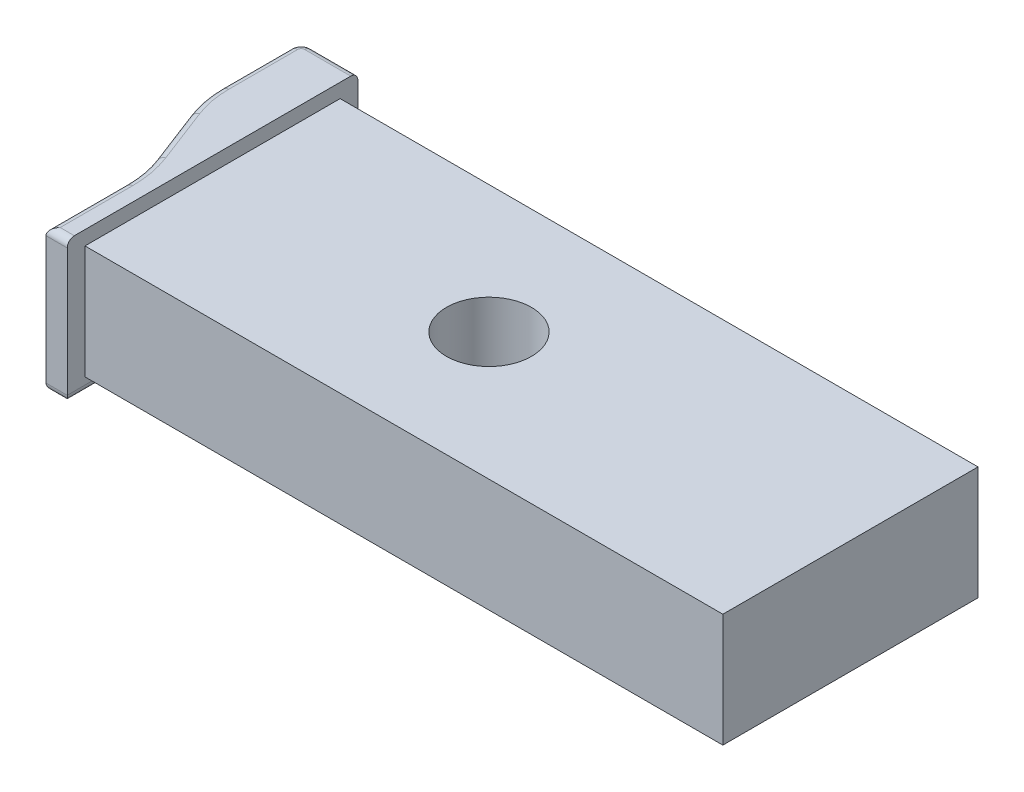
from build123d import *

# Parameters (mm, degrees)
SKETCH_1_W      = 90
SKETCH_1_H      = 36
SKETCH_1_R      = 6
EXTRUDE_1_DEPTH = 16
EXTRUDE_2_DEPTH = 20
FILLET_1_R      = 1
FILLET_2_R      = 1


with BuildPart() as part:
    # Эскиз1 → Бобышка-Вытянуть1 (new body)
    with BuildSketch(Plane(origin=(0, 0, 0), x_dir=(1, 0, 0), z_dir=(0, 1, 0))):
        Rectangle(SKETCH_1_W, SKETCH_1_H)
        with Locations((-6, 0)):
            Circle(SKETCH_1_R, mode=Mode.SUBTRACT)
    extrude(amount=EXTRUDE_1_DEPTH)

    # Эскиз3 → Бобышка-Вытянуть2 (add)
    with BuildSketch(Plane(origin=(0, 18, 0), x_dir=(1, 0, 0), z_dir=(0, 1, 0))):
        with BuildLine():
            Line((-45, 20.5), (-45, -20.5))
            Line((-45, -20.5), (-48, -20.5))
            Line((-48, -20.5), (-48, -9.285164832))
            ThreePointArc((-48, -9.285164832), (-48.252071986, -6.546804135), (-48.999815907, -3.900478642))
            Line((-48.999815907, -3.900478642), (-52.000184093, 3.900478642))
            ThreePointArc((-52.000184093, 3.900478642), (-52.747928014, 6.546804135), (-53, 9.285164832))
            Line((-53, 9.285164832), (-53, 19))
            ThreePointArc((-53, 19), (-52.560660172, 20.060660172), (-51.5, 20.5))
            Line((-51.5, 20.5), (-45, 20.5))
        make_face()
    extrude(amount=-EXTRUDE_2_DEPTH)

    # Скругление1
    fillet_1_edges = [part.edges().sort_by_distance(p)[0] for p in [
        (-46.5, 18, 20.5),
        (-48, 18, 14.892582416),
        (-48.252071986, 18, 6.546804135),
        (-50.5, 18, 0),
        (-52.747928014, 18, -6.546804135),
        (-53, 18, -14.142582416),
        (-52.560660172, 18, -20.060660172),
        (-48.25, 18, -20.5),
    ]]
    fillet(fillet_1_edges, radius=FILLET_1_R)

    # Скругление2
    fillet_2_edges = [part.edges().sort_by_distance(p)[0] for p in [
        (-45, -2, 0),
        (-46.5, -2, 20.5),
        (-48, -2, 14.892582416),
        (-48.252071986, -2, 6.546804135),
        (-50.5, -2, 0),
        (-52.747928014, -2, -6.546804135),
        (-53, -2, -14.142582416),
        (-52.560660172, -2, -20.060660172),
        (-48.25, -2, -20.5),
    ]]
    fillet(fillet_2_edges, radius=FILLET_2_R)


solid = part.part
